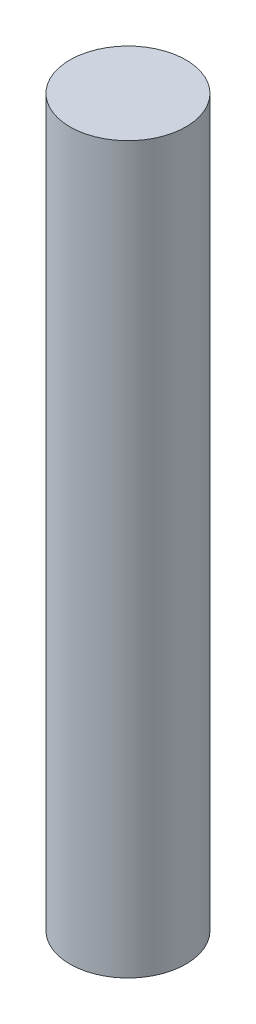
from build123d import *

# Parameters (mm, degrees)
SKETCH1_R           = 40
BOSS_EXTRUDE1_DEPTH = 500
SKETCH2_R           = 30
CUT_EXTRUDE1_DEPTH  = 10
SKETCH3_R           = 35
CUT_EXTRUDE2_DEPTH  = 10


with BuildPart() as part:
    # Sketch1 → Boss-Extrude1 (new body)
    with BuildSketch(Plane(origin=(0, 0, 0), x_dir=(1, 0, 0), z_dir=(0, 1, 0))):
        Circle(SKETCH1_R)
    extrude(amount=BOSS_EXTRUDE1_DEPTH)

    # Sketch2 → Cut-Extrude1 (cut)
    with BuildSketch(Plane(origin=(0, 0, 0), x_dir=(-1, 0, 0), z_dir=(0, -1, 0))):
        Circle(SKETCH2_R)
    extrude(amount=-CUT_EXTRUDE1_DEPTH, mode=Mode.SUBTRACT)

    # Sketch3 → Cut-Extrude2 (cut)
    with BuildSketch(Plane(origin=(0, 10, 0), x_dir=(-1, 0, 0), z_dir=(0, -1, 0))):
        Circle(SKETCH3_R)
    extrude(amount=-CUT_EXTRUDE2_DEPTH, mode=Mode.SUBTRACT)


solid = part.part
